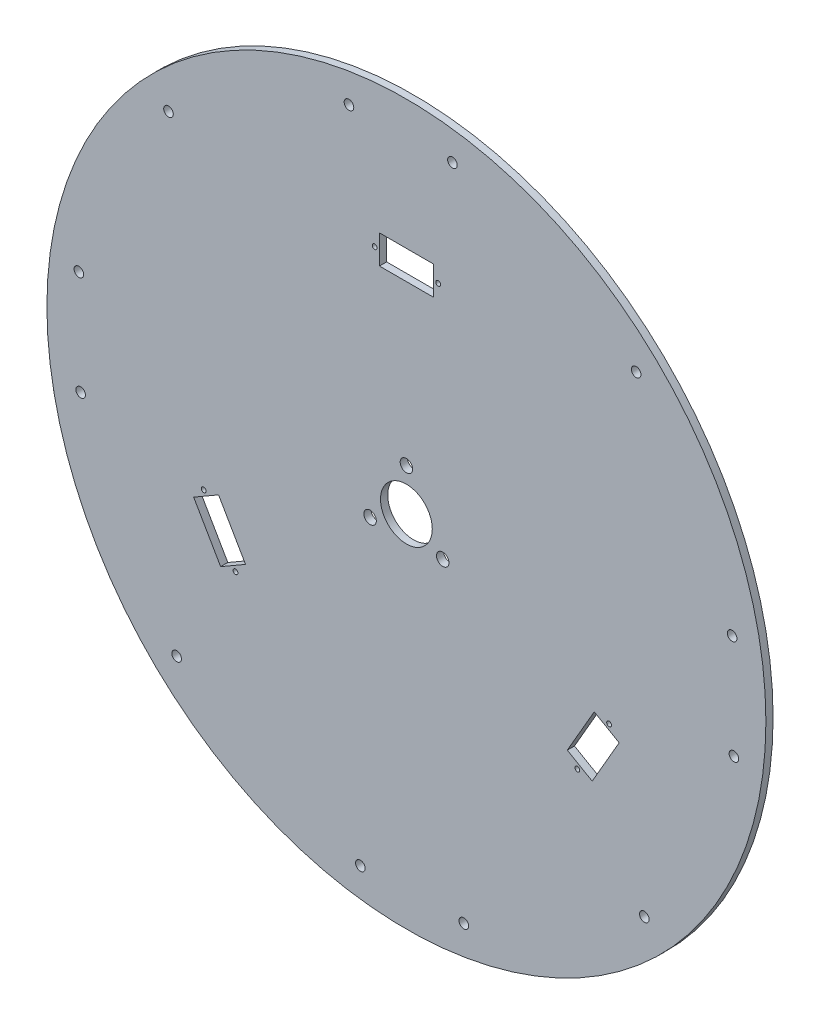
from build123d import *

# Parameters (mm, degrees)
CROQUIS1_R              = 150
CROQUIS1_R_2            = 10.8
CROQUIS1_R_3            = 2.6
CROQUIS1_W              = 22.5
CROQUIS1_H              = 12
SALIENTE_EXTRUIR1_DEPTH = 3
CROQUIS3_R              = 2
CORTAR_EXTRUIR1_DEPTH   = 213.153246499
CROQUIS4_R              = 1
CORTAR_EXTRUIR2_DEPTH   = 10
MATRIZC1_COUNT          = 3


with BuildPart() as part:
    # Croquis1 → Saliente-Extruir1 (new body)
    with BuildSketch(Plane.XY):
        Circle(CROQUIS1_R)
        Circle(CROQUIS1_R_2, mode=Mode.SUBTRACT)
        with Locations((0, 17.5)):
            Circle(CROQUIS1_R_3, mode=Mode.SUBTRACT)
        with Locations((15.155444566, -8.75)):
            Circle(CROQUIS1_R_3, mode=Mode.SUBTRACT)
        with Locations((-15.155444566, -8.75)):
            Circle(CROQUIS1_R_3, mode=Mode.SUBTRACT)
        with Locations((0, 90)):
            Rectangle(CROQUIS1_W, CROQUIS1_H, mode=Mode.SUBTRACT)
        Polygon((88.763438763, -38.257214207), (78.371133918, -32.257214207), (67.121133918, -51.742785793), (77.513438763, -57.742785793), align=None, mode=Mode.SUBTRACT)
        Polygon((-77.513438763, -57.742785793), (-67.121133918, -51.742785793), (-78.371133918, -32.257214207), (-88.763438763, -38.257214207), align=None, mode=Mode.SUBTRACT)
    extrude(amount=SALIENTE_EXTRUIR1_DEPTH)

    # Croquis3 → Cortar-Extruir1 (cut, through all)
    with BuildSketch(Plane.XY.offset(3)):
        with Locations((-99.268892447, 95.862855123)):
            Circle(CROQUIS3_R)
        with Locations((-23.963448518, 135.903469916)):
            Circle(CROQUIS3_R)
        with Locations((19.205887932, 136.656993486)):
            Circle(CROQUIS3_R)
        with Locations((95.862855123, 99.268892447)):
            Circle(CROQUIS3_R)
        with Locations((135.903469916, 23.963448518)):
            Circle(CROQUIS3_R)
        with Locations((136.656993486, -19.205887932)):
            Circle(CROQUIS3_R)
        with Locations((99.268892447, -95.862855123)):
            Circle(CROQUIS3_R)
        with Locations((23.963448518, -135.903469916)):
            Circle(CROQUIS3_R)
        with Locations((-19.205887932, -136.656993486)):
            Circle(CROQUIS3_R)
        with Locations((-95.862855123, -99.268892447)):
            Circle(CROQUIS3_R)
        with Locations((-135.903469916, -23.963448518)):
            Circle(CROQUIS3_R)
        with Locations((-136.656993486, 19.205887932)):
            Circle(CROQUIS3_R)
    extrude(amount=-CORTAR_EXTRUIR1_DEPTH, mode=Mode.SUBTRACT)

    # Croquis4 → Cortar-Extruir2 (cut)
    with BuildSketch(Plane(origin=(0, 0, 0), x_dir=(-1, 0, 0), z_dir=(0, 0, -1))):
        with Locations((-13.25, 90)):
            Circle(CROQUIS4_R)
        with Locations((13.25, 90)):
            Circle(CROQUIS4_R)
    cortar_extruir2 = extrude(amount=-CORTAR_EXTRUIR2_DEPTH, mode=Mode.SUBTRACT)

    # MatrizC1: Cortar-Extruir2 ×3 about axis
    matrizc1_axis = Axis((0, 0, 0), (0, 0, 1))
    for i in range(1, MATRIZC1_COUNT):
        add(cortar_extruir2.rotate(matrizc1_axis, i * 360 / MATRIZC1_COUNT), mode=Mode.SUBTRACT)


solid = part.part
